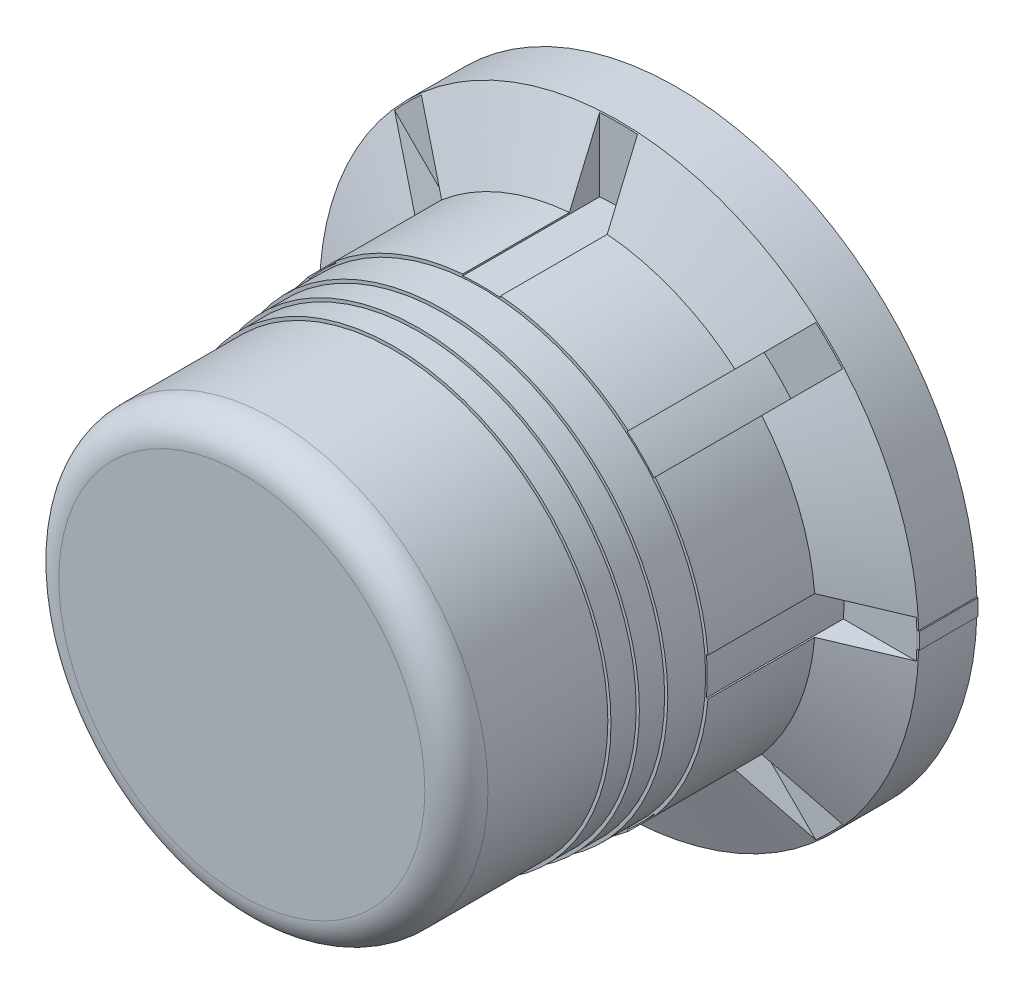
from build123d import *

# Parameters (mm, degrees)
CROQUIS1_R              = 47.5
SALIENTE_EXTRUIR1_DEPTH = 9
CROQUIS2_R              = 36
SALIENTE_EXTRUIR2_DEPTH = 22
CROQUIS3_R              = 35.5
SALIENTE_EXTRUIR3_DEPTH = 6
CROQUIS4_R              = 35
SALIENTE_EXTRUIR4_DEPTH = 4
CROQUIS5_R              = 34.5
SALIENTE_EXTRUIR5_DEPTH = 4
CROQUIS6_R              = 34
SALIENTE_EXTRUIR6_DEPTH = 24
REDONDEO1_R             = 5
CHAFL_N1_SIZE           = 5.093697795
CHAFL_N1_SIZE_2         = 12
CORTAR_EXTRUIR1_START   = -59.7
CORTAR_EXTRUIR1_DEPTH   = 59.7
MATRIZC1_COUNT          = 8
SALIENTE_EXTRUIR7_REACH = 91.87
CROQUIS8_W              = 0.328373722
CROQUIS8_H              = 2.57874632


with BuildPart() as part:
    # Croquis1 → Saliente-Extruir1 (new body)
    with BuildSketch(Plane.XY):
        Circle(CROQUIS1_R)
    extrude(amount=SALIENTE_EXTRUIR1_DEPTH)

    # Croquis2 → Saliente-Extruir2 (add)
    with BuildSketch(Plane.XY.offset(9)):
        Circle(CROQUIS2_R)
    extrude(amount=SALIENTE_EXTRUIR2_DEPTH)

    # Croquis3 → Saliente-Extruir3 (add)
    with BuildSketch(Plane.XY.offset(31)):
        Circle(CROQUIS3_R)
    extrude(amount=SALIENTE_EXTRUIR3_DEPTH)

    # Croquis4 → Saliente-Extruir4 (add)
    with BuildSketch(Plane.XY.offset(37)):
        Circle(CROQUIS4_R)
    extrude(amount=SALIENTE_EXTRUIR4_DEPTH)

    # Croquis5 → Saliente-Extruir5 (add)
    with BuildSketch(Plane.XY.offset(41)):
        Circle(CROQUIS5_R)
    extrude(amount=SALIENTE_EXTRUIR5_DEPTH)

    # Croquis6 → Saliente-Extruir6 (add)
    with BuildSketch(Plane.XY.offset(45)):
        Circle(CROQUIS6_R)
    extrude(amount=SALIENTE_EXTRUIR6_DEPTH)

    # Redondeo1
    redondeo1_edges = [part.edges().sort_by_distance(p)[0] for p in [
        (-34, 0, 69),
    ]]
    fillet(redondeo1_edges, radius=REDONDEO1_R)

    # Chaflán1
    # the kernel refuses this chamfer: 12, 5.093697795 mm, written as the material it adds along each edge
    with BuildSketch(Plane(origin=(0, 0, 9), x_dir=(1, 0, 0), z_dir=(0, -1, 0))) as chafl_n1_piece_1_section:
        Polygon((36, CHAFL_N1_SIZE), (36 + CHAFL_N1_SIZE_2, 0), (36, 0), align=None)
    chafl_n1_piece_1 = revolve(axis=Axis((0, 0, 9), (0, 0, 1)), mode=Mode.PRIVATE)
    chafl_n1_piece_1 = chafl_n1_piece_1 & Plane(origin=(0, 0, 11.556485036), x_dir=(1, 0, 0), z_dir=(0, 0, -1)) * Cylinder(47.5, 192, mode=Mode.PRIVATE)
    add(chafl_n1_piece_1)

    # Croquis7 → Cortar-Extruir1 (cut)
    with BuildSketch(Plane.XY.offset(69).offset(CORTAR_EXTRUIR1_START)):
        with BuildLine():
            Line((-47.405168495, 3), (-35.624047548, 3))
            ThreePointArc((-35.624047548, 3), (-35.750143548, 0), (-35.624047548, -3))
            Line((-35.624047548, -3), (-47.405168495, -3))
            ThreePointArc((-47.405168495, -3), (-47.5, 0), (-47.405168495, 3))
        make_face()
    cortar_extruir1 = extrude(amount=CORTAR_EXTRUIR1_DEPTH, mode=Mode.SUBTRACT)

    # MatrizC1: Cortar-Extruir1 ×8 about axis
    matrizc1_axis = Axis((0, 0, 0), (0, 0, 1))
    for i in range(1, MATRIZC1_COUNT):
        add(cortar_extruir1.rotate(matrizc1_axis, i * 360 / MATRIZC1_COUNT), mode=Mode.SUBTRACT)

    # Saliente-Extruir7: up to this face of the body (flat: up to its plane)
    saliente_extruir7_end = Plane(part.part.faces().sort_by_distance((0, 0, 0))[0])
    # Croquis8 → Saliente-Extruir7 (add, up to the picked face)
    with BuildSketch(Plane.XY.offset(9.3), mode=Mode.PRIVATE) as saliente_extruir7_sk1:
        with Locations((47.5, 0)):
            Rectangle(CROQUIS8_W, CROQUIS8_H)
    saliente_extruir7_tool1 = split(extrude(saliente_extruir7_sk1.sketch, amount=-SALIENTE_EXTRUIR7_REACH, mode=Mode.PRIVATE), bisect_by=saliente_extruir7_end, keep=Keep.BOTH, mode=Mode.PRIVATE)
    add(saliente_extruir7_tool1.solids().sort_by(Axis((47.5, 0, 9.3), (0, 0, -1)))[0])


solid = part.part
